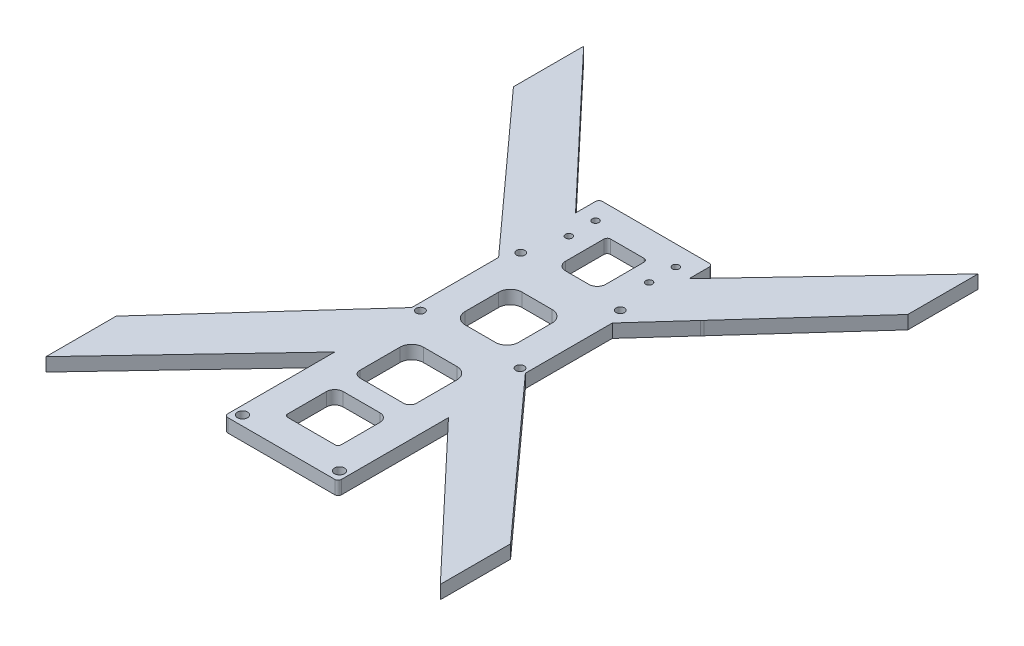
from build123d import *

# Parameters (mm, degrees)
FRAME_SKETCH_R           = 1.5
FRAME_SKETCH_R_2         = 1.25
FRAME_SKETCH_R_3         = 1
FRAME_BOTTOM_PLATE_DEPTH = 4


with BuildPart() as part:
    # Frame Sketch → Frame Bottom Plate (new body)
    with BuildSketch(Plane(origin=(0, 0, 0), x_dir=(1, 0, 0), z_dir=(0, 1, 0))):
        with BuildLine():
            Line((22.298083729, 56.140393786), (-9.701916271, 56.140393786))
            ThreePointArc((-9.701916271, 56.140393786), (-10.409023052, 55.847500567), (-10.701916271, 55.140393786))
            Line((-10.701916271, 55.140393786), (-10.701916271, 49.140393786))
            Line((-10.701916271, 49.140393786), (-52.674742656, 93.542748615))
            Line((-52.674742656, 93.542748615), (-52.674742656, 72.542748615))
            Line((-52.674742656, 72.542748615), (-10.701916271, 26.140393786))
            Line((-10.701916271, 26.140393786), (-10.701916271, 0.140393786))
            Line((-10.701916271, 0.140393786), (-23.064124576, -13.52643844))
            add(Edge.make_bspline(
                [(-23.064124576, -13.52643844), (-23.273370365, -13.763675927), (-23.485967277, -13.998732361), (-23.701916271, -14.23153836)],
                knots=[0.98457333, 0.98457333, 0.98457333, 0.98457333, 1, 1, 1, 1], degree=3))
            Line((-23.701916271, -14.23153836), (-52.674742656, -46.261961044))
            Line((-52.674742656, -46.261961044), (-52.674742656, -67.261961044))
            Line((-52.674742656, -67.261961044), (-10.701916271, -22.859606214))
            Line((-10.701916271, -22.859606214), (-10.701916271, -54.859606214))
            ThreePointArc((-10.701916271, -54.859606214), (-10.409023052, -55.566712995), (-9.701916271, -55.859606214))
            Line((-9.701916271, -55.859606214), (22.298083729, -55.859606214))
            ThreePointArc((22.298083729, -55.859606214), (23.00519051, -55.566712995), (23.298083729, -54.859606214))
            Line((23.298083729, -54.859606214), (23.298083729, -22.859606214))
            Line((23.298083729, -22.859606214), (65.270910114, -67.261961044))
            Line((65.270910114, -67.261961044), (65.270910114, -46.261961044))
            Line((65.270910114, -46.261961044), (23.298083729, 0.140393786))
            Line((23.298083729, 0.140393786), (23.298083729, 26.140393786))
            Line((23.298083729, 26.140393786), (35.839011032, 40.004805804))
            add(Edge.make_bspline(
                [(36.298083729, 40.512325932), (36.143349049, 40.344312056), (35.990324697, 40.175130012), (35.839011032, 40.004805804)],
                knots=[0, 0, 0, 0, 0.011122864, 0.011122864, 0.011122864, 0.011122864], degree=3))
            Line((36.298083729, 40.512325932), (65.270910114, 72.542748615))
            Line((65.270910114, 72.542748615), (65.270910114, 93.542748615))
            Line((65.270910114, 93.542748615), (23.298083729, 49.140393786))
            Line((23.298083729, 49.140393786), (23.298083729, 55.140393786))
            ThreePointArc((23.298083729, 55.140393786), (23.00519051, 55.847500567), (22.298083729, 56.140393786))
        make_face()
        with Locations((-8.201916271, -52.959606214)):
            Circle(FRAME_SKETCH_R, mode=Mode.SUBTRACT)
        with Locations((-8.601916271, 0.640393786)):
            Circle(FRAME_SKETCH_R_2, mode=Mode.SUBTRACT)
        with Locations((20.798083729, -52.959606214)):
            Circle(FRAME_SKETCH_R, mode=Mode.SUBTRACT)
        with BuildLine():
            Line((13.438477515, -46.859606214), (-0.842310056, -46.859606214))
            ThreePointArc((-0.842310056, -46.859606214), (-1.45014344, -46.607833383), (-1.701916271, -46))
            Line((-1.701916271, -46), (-1.701916271, -34.359606214))
            ThreePointArc((-1.701916271, -34.359606214), (-0.969683224, -32.591839261), (0.798083729, -31.859606214))
            Line((0.798083729, -31.859606214), (11.798083729, -31.859606214))
            ThreePointArc((11.798083729, -31.859606214), (13.565850682, -32.591839261), (14.298083729, -34.359606214))
            Line((14.298083729, -34.359606214), (14.298083729, -46))
            ThreePointArc((14.298083729, -46), (14.046310898, -46.607833383), (13.438477515, -46.859606214))
        make_face(mode=Mode.SUBTRACT)
        with BuildLine():
            ThreePointArc((14.798083729, -23.859606214), (14.212297292, -25.273819777), (12.798083729, -25.859606214))
            Line((12.798083729, -25.859606214), (-0.201916271, -25.859606214))
            ThreePointArc((-0.201916271, -25.859606214), (-1.616129833, -25.273819777), (-2.201916271, -23.859606214))
            Line((-2.201916271, -23.859606214), (-2.201916271, -11.859606214))
            ThreePointArc((-2.201916271, -11.859606214), (-1.176790005, -9.38473248), (1.298083729, -8.359606214))
            Line((1.298083729, -8.359606214), (11.298083729, -8.359606214))
            ThreePointArc((11.298083729, -8.359606214), (13.772957463, -9.38473248), (14.798083729, -11.859606214))
            Line((14.798083729, -11.859606214), (14.798083729, -23.859606214))
        make_face(mode=Mode.SUBTRACT)
        with BuildLine():
            Line((10.798083729, 3.640393786), (1.798083729, 3.640393786))
            ThreePointArc((1.798083729, 3.640393786), (-0.676790005, 4.665520052), (-1.701916271, 7.140393786))
            Line((-1.701916271, 7.140393786), (-1.701916271, 17.140393786))
            ThreePointArc((-1.701916271, 17.140393786), (-0.676790005, 19.61526752), (1.798083729, 20.640393786))
            Line((1.798083729, 20.640393786), (10.798083729, 20.640393786))
            ThreePointArc((10.798083729, 20.640393786), (13.272957463, 19.61526752), (14.298083729, 17.140393786))
            Line((14.298083729, 17.140393786), (14.298083729, 7.140393786))
            ThreePointArc((14.298083729, 7.140393786), (13.272957463, 4.665520052), (10.798083729, 3.640393786))
        make_face(mode=Mode.SUBTRACT)
        with Locations((21.198083729, 0.640393786)):
            Circle(FRAME_SKETCH_R_2, mode=Mode.SUBTRACT)
        with Locations((-8.601916271, 30.640393786)):
            Circle(FRAME_SKETCH_R_2, mode=Mode.SUBTRACT)
        with Locations((-5.701916271, 42.140393786)):
            Circle(FRAME_SKETCH_R_3, mode=Mode.SUBTRACT)
        with Locations((-5.701916271, 50.140393786)):
            Circle(FRAME_SKETCH_R_3, mode=Mode.SUBTRACT)
        with Locations((21.198083729, 30.640393786)):
            Circle(FRAME_SKETCH_R_2, mode=Mode.SUBTRACT)
        with BuildLine():
            Line((9.798083729, 32.640393786), (2.798083729, 32.640393786))
            ThreePointArc((2.798083729, 32.640393786), (1.030316776, 33.372626833), (0.298083729, 35.140393786))
            Line((0.298083729, 35.140393786), (0.298083729, 46.640393786))
            ThreePointArc((0.298083729, 46.640393786), (0.590976948, 47.347500567), (1.298083729, 47.640393786))
            Line((1.298083729, 47.640393786), (11.298083729, 47.640393786))
            ThreePointArc((11.298083729, 47.640393786), (12.00519051, 47.347500567), (12.298083729, 46.640393786))
            Line((12.298083729, 46.640393786), (12.298083729, 35.140393786))
            ThreePointArc((12.298083729, 35.140393786), (11.565850682, 33.372626833), (9.798083729, 32.640393786))
        make_face(mode=Mode.SUBTRACT)
        with Locations((18.298083729, 42.140393786)):
            Circle(FRAME_SKETCH_R_3, mode=Mode.SUBTRACT)
        with Locations((18.298083729, 50.140393786)):
            Circle(FRAME_SKETCH_R_3, mode=Mode.SUBTRACT)
    extrude(amount=FRAME_BOTTOM_PLATE_DEPTH)


solid = part.part
